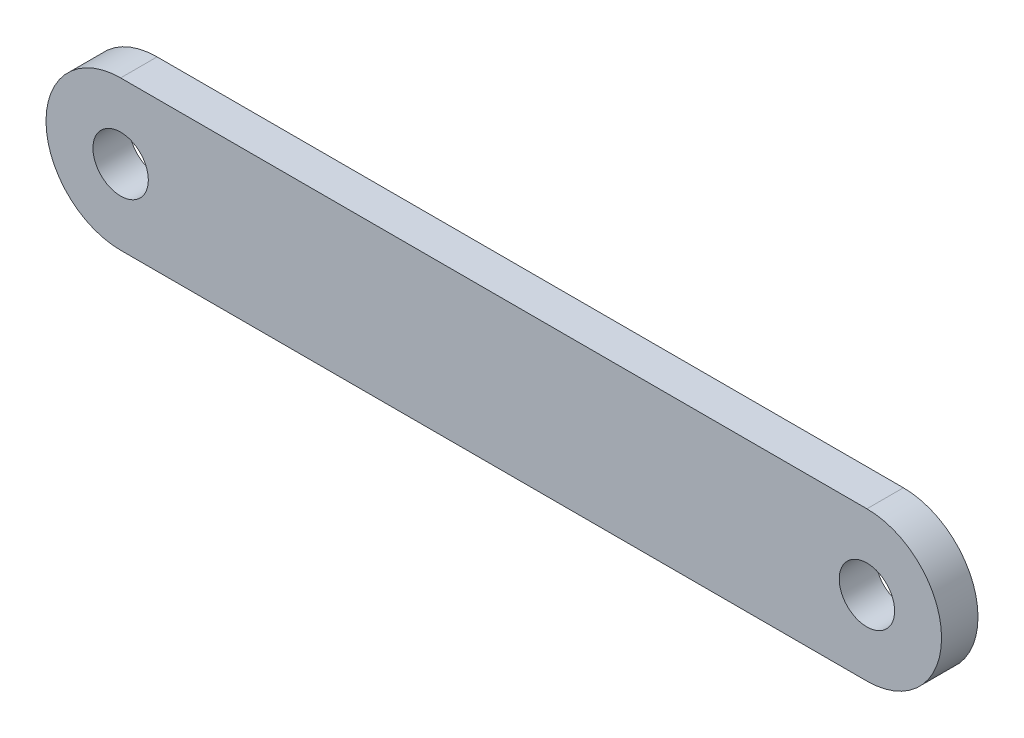
from build123d import *

# Parameters (mm, degrees)
SKETCH1_R           = 2.413
BOSS_EXTRUDE1_DEPTH = 3.175


with BuildPart() as part:
    # Sketch1 → Boss-Extrude1 (new body)
    with BuildSketch(Plane.XY):
        with BuildLine():
            Line((-32.5, 6.5), (32.5, 6.5))
            ThreePointArc((32.5, 6.5), (39, 0), (32.5, -6.5))
            Line((32.5, -6.5), (-32.5, -6.5))
            ThreePointArc((-32.5, -6.5), (-39, 0), (-32.5, 6.5))
        make_face()
        with Locations((-32.5, 0)):
            Circle(SKETCH1_R, mode=Mode.SUBTRACT)
        with Locations((32.5, 0)):
            Circle(SKETCH1_R, mode=Mode.SUBTRACT)
    extrude(amount=BOSS_EXTRUDE1_DEPTH)


solid = part.part
